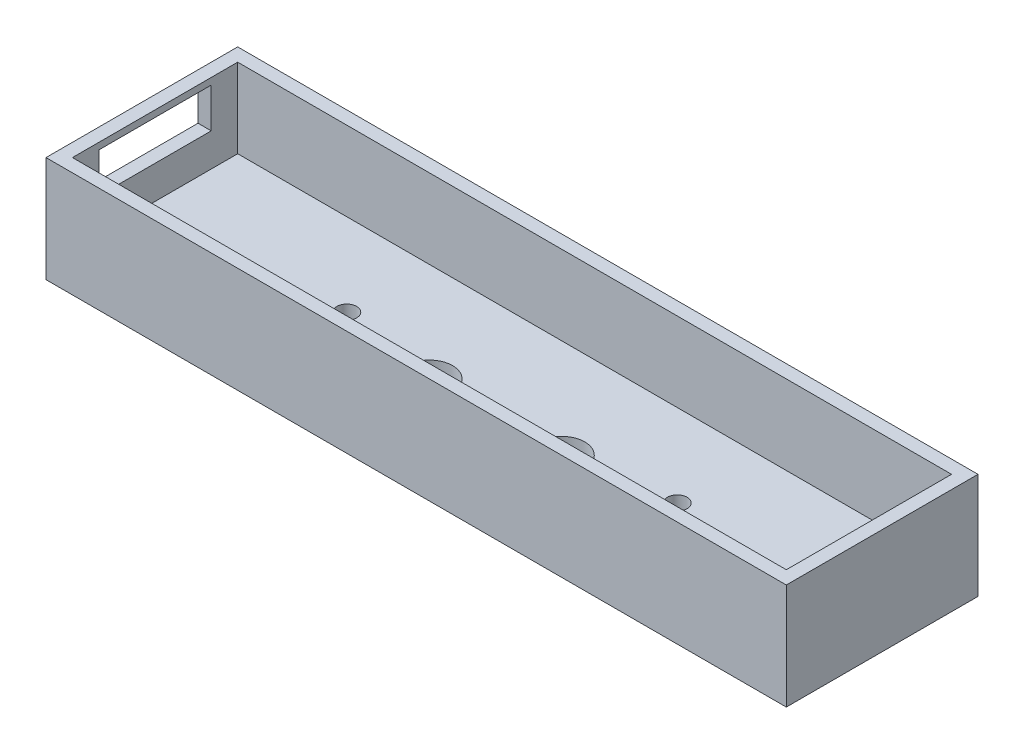
from build123d import *

# Parameters (mm, degrees)
SKETCH1_W                = 108
SKETCH1_H                = 25
BOSS_EXTRUDE1_DEPTH      = 4
CUT_EXTRUDE1_REACH       = 70.301
SKETCH2_R                = 1.5
CUT_EXTRUDE3_START       = -2
SKETCH3_R                = 3.5
SKETCH3_R_2              = 1.5
CUT_EXTRUDE3_DEPTH       = 2
CUT_EXTRUDE4_REACH       = 70.301
SKETCH4_R                = 1.25
SKETCH5_R                = 3.5
CUT_EXTRUDE5_DEPTH       = 1.7
BOSS_EXTRUDE2_DEPTH      = 12
BOSS_EXTRUDE2_DEPTH_BACK = 4
SKETCH6_W                = 112
SKETCH6_H                = 29
SKETCH6_W_2              = 108
SKETCH6_H_2              = 25
CUT_EXTRUDE7_REACH       = 117.031
SKETCH8_W                = 17
SKETCH8_H                = 6


with BuildPart() as part:
    # Sketch1 → Boss-Extrude1 (new body)
    with BuildSketch(Plane(origin=(0, 0, 0), x_dir=(1, 0, 0), z_dir=(0, 1, 0))):
        with Locations((11.544540658, 6.287491884)):
            Rectangle(SKETCH1_W, SKETCH1_H)
    extrude(amount=BOSS_EXTRUDE1_DEPTH)

    # Sketch2 → Cut-Extrude1 (cut, up to next)
    with BuildSketch(Plane(origin=(0, 4, 0), x_dir=(1, 0, 0), z_dir=(0, 1, 0)), mode=Mode.PRIVATE) as cut_extrude1_sk1:
        with Locations((-13.455459342, 6.287491884)):
            Circle(SKETCH2_R)
    cut_extrude1_tool1 = extrude(cut_extrude1_sk1.sketch, amount=-CUT_EXTRUDE1_REACH, mode=Mode.PRIVATE) & part.part
    # Sketch2 → Cut-Extrude1 (cut, up to next)
    with BuildSketch(Plane(origin=(0, 4, 0), x_dir=(1, 0, 0), z_dir=(0, 1, 0)), mode=Mode.PRIVATE) as cut_extrude1_sk2:
        with Locations((36.544540658, 6.287491884)):
            Circle(SKETCH2_R)
    cut_extrude1_tool2 = extrude(cut_extrude1_sk2.sketch, amount=-CUT_EXTRUDE1_REACH, mode=Mode.PRIVATE) & part.part
    add(cut_extrude1_tool1.solids().sort_by_distance((-13.455459, 4, -6.287492))[0], mode=Mode.SUBTRACT)
    add(cut_extrude1_tool2.solids().sort_by_distance((36.544541, 4, -6.287492))[0], mode=Mode.SUBTRACT)

    # Sketch3 → Cut-Extrude3 (cut)
    # profile 1 of 2: a face of its own
    with BuildSketch(Plane(origin=(0, 0, 0), x_dir=(-1, 0, 0), z_dir=(0, -1, 0)).offset(CUT_EXTRUDE3_START)):
        with Locations((-36.544540658, 6.287491884)):
            Circle(SKETCH3_R)
    # profile 2 of 2: a face of its own
    with BuildSketch(Plane(origin=(0, 0, 0), x_dir=(-1, 0, 0), z_dir=(0, -1, 0)).offset(CUT_EXTRUDE3_START)):
        with Locations((13.455459342, 6.287491884)):
            Circle(SKETCH3_R)
        with Locations((13.455459342, 6.287491884)):
            Circle(SKETCH3_R_2, mode=Mode.SUBTRACT)
    extrude(amount=CUT_EXTRUDE3_DEPTH, mode=Mode.SUBTRACT)

    # Sketch4 → Cut-Extrude4 (cut, up to next)
    with BuildSketch(Plane(origin=(0, 4, 0), x_dir=(1, 0, 0), z_dir=(0, 1, 0)), mode=Mode.PRIVATE) as cut_extrude4_sk1:
        with Locations((21.544540658, 3.787491884)):
            Circle(SKETCH4_R)
    cut_extrude4_tool1 = extrude(cut_extrude4_sk1.sketch, amount=-CUT_EXTRUDE4_REACH, mode=Mode.PRIVATE) & part.part
    # Sketch4 → Cut-Extrude4 (cut, up to next)
    with BuildSketch(Plane(origin=(0, 4, 0), x_dir=(1, 0, 0), z_dir=(0, 1, 0)), mode=Mode.PRIVATE) as cut_extrude4_sk2:
        with Locations((1.544540658, 3.787491884)):
            Circle(SKETCH4_R)
    cut_extrude4_tool2 = extrude(cut_extrude4_sk2.sketch, amount=-CUT_EXTRUDE4_REACH, mode=Mode.PRIVATE) & part.part
    add(cut_extrude4_tool1.solids().sort_by_distance((21.544541, 4, -3.787492))[0], mode=Mode.SUBTRACT)
    add(cut_extrude4_tool2.solids().sort_by_distance((1.544541, 4, -3.787492))[0], mode=Mode.SUBTRACT)

    # Sketch5 → Cut-Extrude5 (cut)
    with BuildSketch(Plane(origin=(0, 4, 0), x_dir=(1, 0, 0), z_dir=(0, 1, 0))):
        with Locations((21.544540658, 3.787491884)):
            Circle(SKETCH5_R)
        with Locations((1.544540658, 3.787491884)):
            Circle(SKETCH5_R)
    extrude(amount=-CUT_EXTRUDE5_DEPTH, mode=Mode.SUBTRACT)

    # Sketch6 → Boss-Extrude2 (add, two sides: drawn at the far end of the back side and taken through both)
    with BuildSketch(Plane(origin=(0, 4, 0), x_dir=(1, 0, 0), z_dir=(0, 1, 0)).offset(-BOSS_EXTRUDE2_DEPTH_BACK)):
        with Locations((11.544540658, 6.287491884)):
            Rectangle(SKETCH6_W, SKETCH6_H)
        with Locations((11.544540658, 6.287491884)):
            Rectangle(SKETCH6_W_2, SKETCH6_H_2, mode=Mode.SUBTRACT)
    extrude(amount=BOSS_EXTRUDE2_DEPTH + BOSS_EXTRUDE2_DEPTH_BACK)

    # Sketch8 → Cut-Extrude7 (cut, up to next)
    with BuildSketch(Plane.ZY.offset(44.455459342), mode=Mode.PRIVATE) as cut_extrude7_sk1:
        with Locations((-6.287491884, 12)):
            Rectangle(SKETCH8_W, SKETCH8_H)
    cut_extrude7_tool1 = extrude(cut_extrude7_sk1.sketch, amount=-CUT_EXTRUDE7_REACH, mode=Mode.PRIVATE) & part.part
    add(cut_extrude7_tool1.solids().sort_by_distance((-44.455459, 12, -6.287492))[0], mode=Mode.SUBTRACT)


solid = part.part
